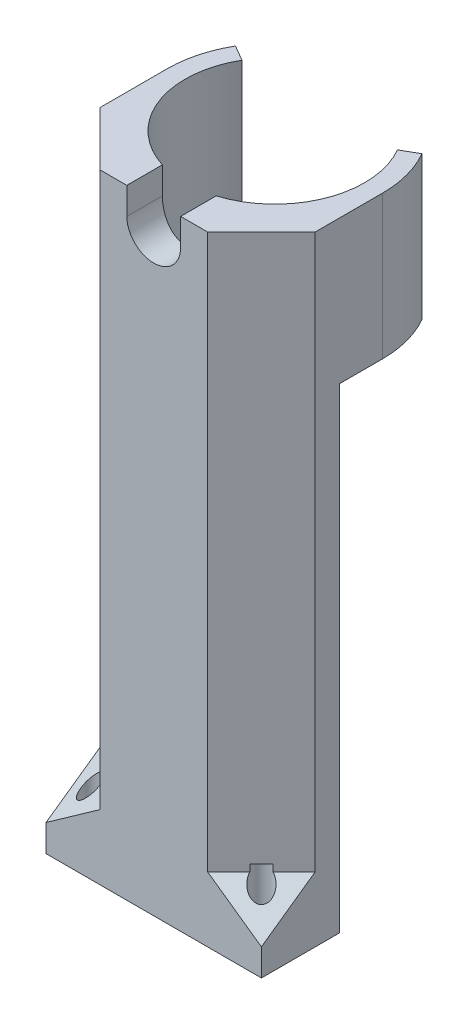
from build123d import *

# Parameters (mm, degrees)
BOSS_EXTRUDE1_DEPTH      = 56
BOSS_EXTRUDE2_DEPTH      = 16
BOSS_EXTRUDE3_DEPTH      = 3
BOSS_EXTRUDE3_DEPTH_BACK = 8
SKETCH4_W                = 24
SKETCH4_H                = 27
SKETCH5_W                = 28.405044576
SKETCH5_H                = 3.736732925
CUT_EXTRUDE2_DEPTH       = 78.826730626
CUT_EXTRUDE3_DEPTH       = 75.231058305
CUT_EXTRUDE5_DEPTH       = 3
CUT_EXTRUDE5_DEPTH_BACK  = 75.231058305
SKETCH8_W                = 24
SKETCH8_H                = 27
BOSS_EXTRUDE4_DEPTH      = 3
CHAMFER1_SIZE            = 4.25
SKETCH14_R               = 1.15
CUT_EXTRUDE8_DEPTH       = 8
CUT_EXTRUDE9_START       = -3
CUT_EXTRUDE9_DEPTH       = 1.8


with BuildPart() as part:
    # Sketch2 → Boss-Extrude1 (new body)
    with BuildSketch(Plane(origin=(0, 0, 0), x_dir=(1, 0, 0), z_dir=(0, 1, 0))):
        with BuildLine():
            Line((12, -13.5), (-12, -13.5))
            Line((-12, -13.5), (-12, -4.795831523))
            Line((-12, -4.795831523), (-11, -4.795831523))
            ThreePointArc((-11, -4.795831523), (0, -12), (11, -4.795831523))
            Line((11, -4.795831523), (12, -4.795831523))
            Line((12, -4.795831523), (12, -13.5))
        make_face()
    extrude(amount=BOSS_EXTRUDE1_DEPTH)

    # Sketch3 → Boss-Extrude2 (add)
    with BuildSketch(Plane(origin=(0, 56, 0), x_dir=(1, 0, 0), z_dir=(0, 1, 0))):
        with BuildLine():
            Line((-12, -13.5), (12, -13.5))
            Line((12, -13.5), (12, 0))
            ThreePointArc((12, 0), (11.591109915, 3.105828541), (10.392304845, 6))
            Line((10.392304845, 6), (8.660254038, 5))
            ThreePointArc((8.660254038, 5), (0, -10), (-8.660254038, 5))
            Line((-8.660254038, 5), (-10.392304845, 6))
            ThreePointArc((-10.392304845, 6), (-11.591109915, 3.105828541), (-12, 0))
            Line((-12, 0), (-12, -13.5))
        make_face()
    extrude(amount=BOSS_EXTRUDE2_DEPTH)

    # Sketch4 → Boss-Extrude3 (add, two sides: drawn at the far end of the back side and taken through both)
    with BuildSketch(Plane(origin=(0, 0, 0), x_dir=(1, 0, 0), z_dir=(0, 1, 0)).offset(-BOSS_EXTRUDE3_DEPTH_BACK)):
        Rectangle(SKETCH4_W, SKETCH4_H)
    extrude(amount=BOSS_EXTRUDE3_DEPTH + BOSS_EXTRUDE3_DEPTH_BACK)

    # Sketch5 → Cut-Revolve1 (revolve, cut)
    with BuildSketch(Plane(origin=(0, 0, 0), x_dir=(0, 0, -1), z_dir=(1, 0, 0))):
        with Locations((0.702522288, -8.868366462)):
            Rectangle(SKETCH5_W, SKETCH5_H)
    revolve(axis=Axis((0, 72, 13.5), (0, 0, -1)), mode=Mode.SUBTRACT)

    # Sketch6 → Cut-Extrude2 (cut, through all)
    with BuildSketch(Plane.XY.offset(13.5)):
        with BuildLine():
            Line((-3, 72), (-3, 69))
            ThreePointArc((-3, 69), (0, 66), (3, 69))
            Line((3, 69), (3, 72))
            Line((3, 72), (-3, 72))
        make_face()
    extrude(amount=-CUT_EXTRUDE2_DEPTH, mode=Mode.SUBTRACT)

    # Sketch7 → Cut-Extrude3 (cut, through all)
    with BuildSketch(Plane(origin=(0, 0, 0), x_dir=(1, 0, 0), z_dir=(0, 1, 0))):
        Polygon((6, -13.5), (12, -7.5), (12, -13.5), align=None)
        Polygon((-6, -13.5), (-12, -13.5), (-12, -7.5), align=None)
    extrude(amount=CUT_EXTRUDE3_DEPTH, mode=Mode.SUBTRACT)

    # Sketch8 → Cut-Extrude5 (cut, two sides: drawn at the far end of the back side and taken through both)
    with BuildSketch(Plane(origin=(0, 0, 0), x_dir=(1, 0, 0), z_dir=(0, 1, 0)).offset(-CUT_EXTRUDE5_DEPTH_BACK)):
        Rectangle(SKETCH8_W, SKETCH8_H)
    extrude(amount=CUT_EXTRUDE5_DEPTH + CUT_EXTRUDE5_DEPTH_BACK, mode=Mode.SUBTRACT)

    # Sketch13 → Boss-Extrude4 (add)
    with BuildSketch(Plane.XZ.offset(-3)):
        Polygon((-12, 7.5), (-12, 13.5), (-6, 13.5), align=None)
        Polygon((6, 13.5), (12, 13.5), (12, 7.5), align=None)
    extrude(amount=-BOSS_EXTRUDE4_DEPTH)

    # Chamfer1
    # the kernel refuses this chamfer: 4.25 mm, written as the material it adds along each edge
    with BuildSketch(Plane(origin=(1.728431539, 6, 21.228431539), x_dir=(-0.7068394360706696, -0.02749587661058644, 0.7068394360706773), z_dir=(-0.7071067811865515, 0, -0.7071067811865437))) as chamfer1_piece_1_section:
        Polygon((CHAMFER1_SIZE * 0.999621916911, CHAMFER1_SIZE * 0.0274958766106), (-CHAMFER1_SIZE * 0.0274958766106, CHAMFER1_SIZE * 0.999621916911), (0, 0), align=None)
    chamfer1_piece_1 = extrude(amount=30.344586772, mode=Mode.PRIVATE)
    chamfer1_piece_1 = split(chamfer1_piece_1, bisect_by=Plane(origin=(-12, 7.617398018, 11.205698206), z_dir=(1, 0, 0)), keep=Keep.TOP, mode=Mode.PRIVATE)
    chamfer1_piece_1 = split(chamfer1_piece_1, bisect_by=Plane(origin=(-9.705698206, 7.617398018, 13.5), z_dir=(0, 0, -1)), keep=Keep.TOP, mode=Mode.PRIVATE)
    add(chamfer1_piece_1)
    with BuildSketch(Plane(origin=(19.728431539, 6, -0.228431539), x_dir=(0.70683943607067, -0.02749587661058643, 0.706839436070677), z_dir=(-0.707106781186551, 0, 0.7071067811865441))) as chamfer1_piece_2_section:
        Polygon((CHAMFER1_SIZE * 0.999621916911, CHAMFER1_SIZE * 0.0274958766106), (-CHAMFER1_SIZE * 0.0274958766106, CHAMFER1_SIZE * 0.999621916911), (0, 0), align=None)
    chamfer1_piece_2 = extrude(amount=30.344586772, mode=Mode.PRIVATE)
    chamfer1_piece_2 = split(chamfer1_piece_2, bisect_by=Plane(origin=(12, 7.617398018, 11.205698206), z_dir=(-1, 0, 0)), keep=Keep.TOP, mode=Mode.PRIVATE)
    chamfer1_piece_2 = split(chamfer1_piece_2, bisect_by=Plane(origin=(9.705698206, 7.617398018, 13.5), z_dir=(0, 0, -1)), keep=Keep.TOP, mode=Mode.PRIVATE)
    add(chamfer1_piece_2)

    # Sketch14 → Cut-Extrude8 (cut)
    with BuildSketch(Plane.XZ.offset(-3)):
        with Locations(Location((-9.5, 11, 0), (0, 0, 270))):
            Circle(SKETCH14_R)
        with Locations(Location((9.5, 11, 0), (0, 0, 277.057128313))):
            Circle(SKETCH14_R)
    extrude(amount=-CUT_EXTRUDE8_DEPTH, mode=Mode.SUBTRACT)

    # Sketch15 → Cut-Extrude9 (cut)
    with BuildSketch(Plane.XZ.offset(-3).offset(CUT_EXTRUDE9_START)):
        Polygon((-7.190598923, 11), (-8.345299462, 13), (-10.654700538, 13), (-11.809401077, 11), (-10.654700538, 9), (-8.345299462, 9), align=None)
        Polygon((11.809401077, 11), (10.654700538, 13), (8.345299462, 13), (7.190598923, 11), (8.345299462, 9), (10.654700538, 9), align=None)
    extrude(amount=CUT_EXTRUDE9_DEPTH, mode=Mode.SUBTRACT)


solid = part.part
